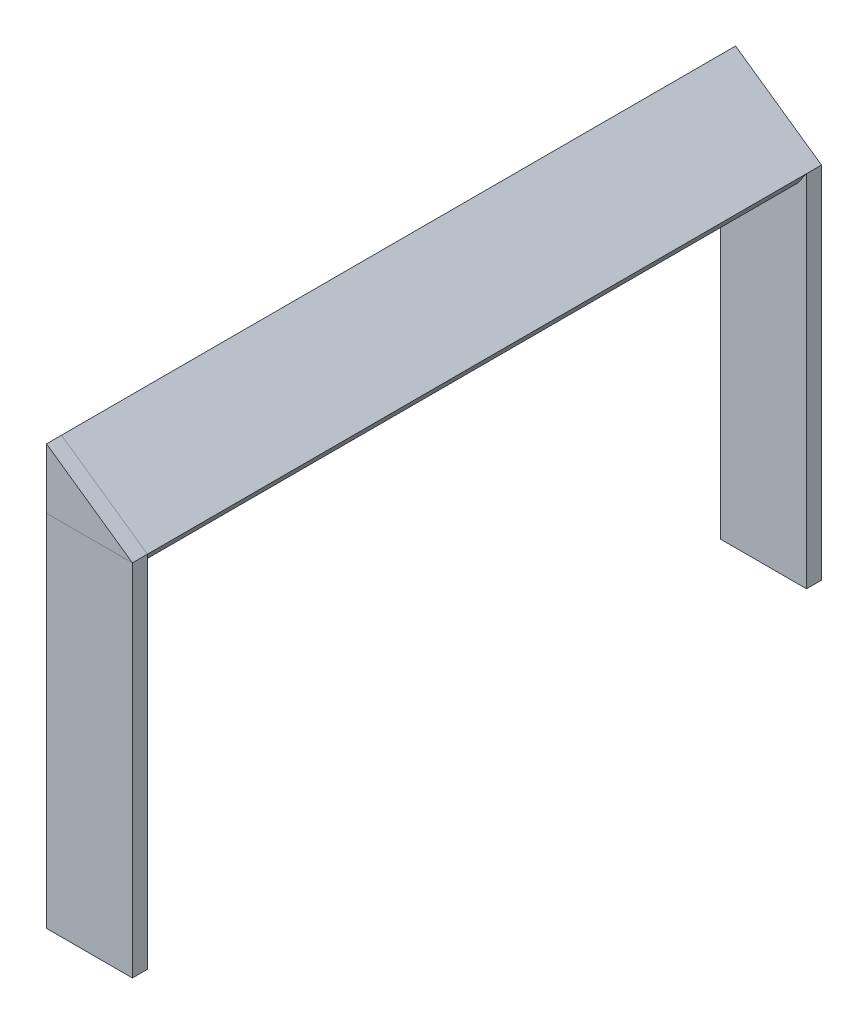
from build123d import *

# Parameters (mm, degrees)
BOSS_EXTRUDE1_DEPTH = 6.35
SKETCH2_W           = 36.411308368
SKETCH2_H           = 152.4
BOSS_EXTRUDE2_DEPTH = 6.35
BOSS_EXTRUDE3_DEPTH = 279.4


with BuildPart() as part:
    # Sketch1 → Boss-Extrude1 (new body)
    with BuildSketch(Plane.XY):
        Polygon((-18.205654184, 25.495472596), (18.205654184, 0), (-18.205654184, 0), align=None)
    boss_extrude1 = extrude(amount=BOSS_EXTRUDE1_DEPTH)


with BuildPart() as body_2:
    # Sketch2 → Boss-Extrude2 (new body)
    with BuildSketch(Plane.XY):
        with Locations((0, -76.2)):
            Rectangle(SKETCH2_W, SKETCH2_H)
    boss_extrude2 = extrude(amount=BOSS_EXTRUDE2_DEPTH)


with BuildPart() as body_3:
    # Sketch3 → Boss-Extrude3 (new body)
    with BuildSketch(Plane.XY):
        Polygon((-18.205654184, 25.495472596), (18.205654184, 0), (14.563443813, -5.201615481), (-21.847864555, 20.293857115), align=None)
    extrude(amount=-BOSS_EXTRUDE3_DEPTH)

    # Symétrie2: Boss-Extrude1, Boss-Extrude2 across plane
    add(boss_extrude1.mirror(Plane.XY.offset(-139.7)))
    add(boss_extrude2.mirror(Plane.XY.offset(-139.7)))


solid = Compound([part.part, body_2.part, body_3.part])
